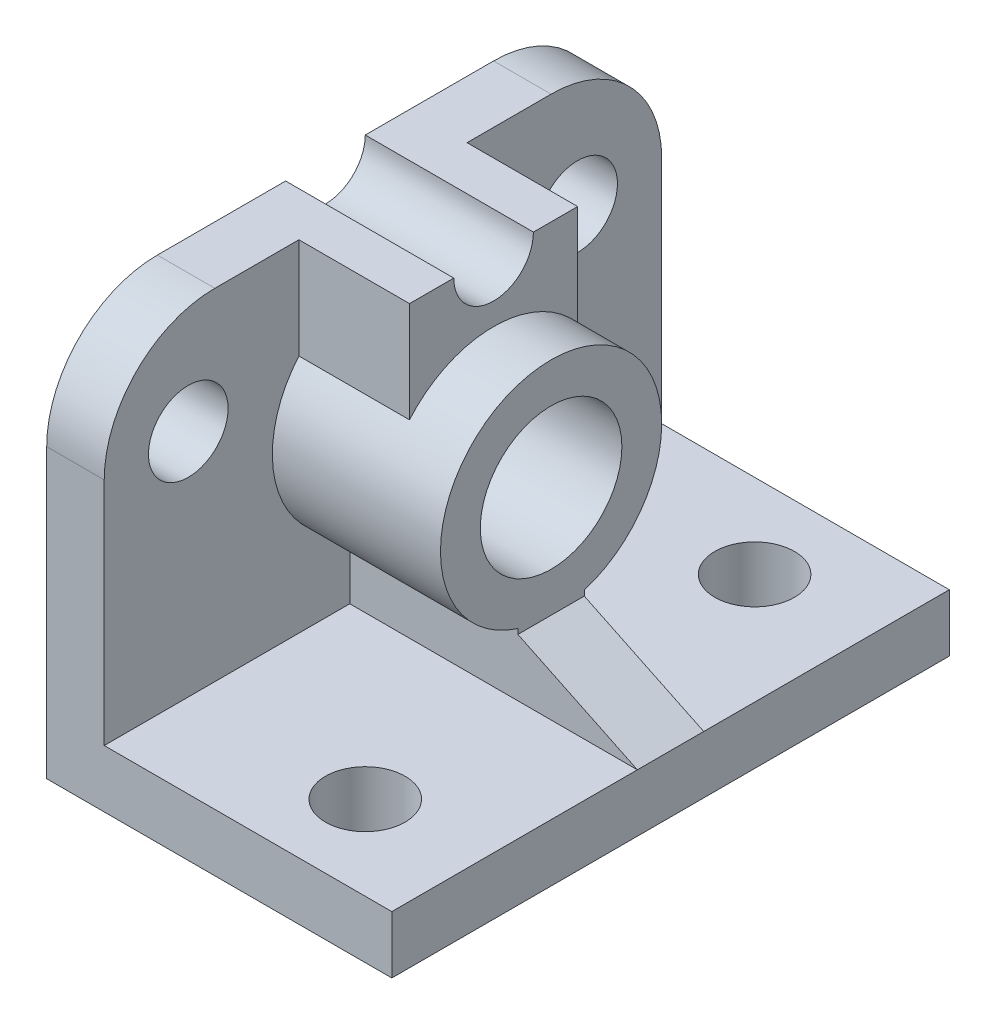
from build123d import *
from build123d.topology import SkipClean

# Parameters (mm, degrees)
SKETCH2_W               = 78
SKETCH2_H               = 126
BOSS_EXTRUDE1_DEPTH     = 13
SKETCH3_W               = 126
SKETCH3_H               = 77
BOSS_EXTRUDE2_DEPTH     = 13
FILLET1_R               = 25
SKETCH4_R               = 9
CUT_EXTRUDE1_DEPTH      = 128.647953372
SKETCH5_R               = 25
BOSS_EXTRUDE3_DEPTH     = 38
BOSS_EXTRUDE4_DEPTH     = 25
CUT_EXTRUDE3_DEPTH      = 128.647953372
CUT_EXTRUDE3_DEPTH_BACK = 128.647953372
SKETCH5_5_R             = 16
RIB1_START              = -7.5
RIB1_DEPTH              = 15
SKETCH7_R               = 9
CUT_EXTRUDE4_DEPTH      = 107.85972113


with BuildPart() as part:
    # Sketch2 → Boss-Extrude1 (new body)
    with BuildSketch(Plane(origin=(0, 0, 0), x_dir=(1, 0, 0), z_dir=(0, 1, 0))):
        Rectangle(SKETCH2_W, SKETCH2_H)
    extrude(amount=BOSS_EXTRUDE1_DEPTH)

    # Sketch3 → Boss-Extrude2 (add)
    with BuildSketch(Plane.ZY.offset(39)):
        with Locations((0, 51.5)):
            Rectangle(SKETCH3_W, SKETCH3_H)
    extrude(amount=-BOSS_EXTRUDE2_DEPTH)

    # Fillet1
    fillet1_edges = [part.edges().sort_by_distance(p)[0] for p in [
        (-32.5, 90, -63),
        (-32.5, 90, 63),
    ]]
    fillet(fillet1_edges, radius=FILLET1_R)

    # Sketch4 → Cut-Extrude1 (cut, through all)
    with BuildSketch(Plane(origin=(-26, 0, 0), x_dir=(0, 0, -1), z_dir=(1, 0, 0))):
        with Locations((-44, 65)):
            Circle(SKETCH4_R)
        with Locations((44, 65)):
            Circle(SKETCH4_R)
    extrude(amount=-CUT_EXTRUDE1_DEPTH, mode=Mode.SUBTRACT)

    # Sketch5 → Boss-Extrude3 (add)
    with BuildSketch(Plane(origin=(-26, 0, 0), x_dir=(0, 0, -1), z_dir=(1, 0, 0))):
        with Locations((0, 51)):
            Circle(SKETCH5_R)
    extrude(amount=BOSS_EXTRUDE3_DEPTH)

    # Sketch5<3> → Boss-Extrude4 (add)
    with BuildSketch(Plane(origin=(-26, 0, 0), x_dir=(0, 0, -1), z_dir=(1, 0, 0))):
        with BuildLine():
            Line((-9, 90), (-19, 90))
            Line((-19, 90), (-19, 67.248076809))
            ThreePointArc((-19, 67.248076809), (0, 76), (19, 67.248076809))
            Line((19, 67.248076809), (19, 90))
            Line((19, 90), (9, 90))
            ThreePointArc((9, 90), (0, 81), (-9, 90))
        make_face()
    extrude(amount=BOSS_EXTRUDE4_DEPTH)

    # Sketch5<5> → Cut-Extrude3 (cut, two sides: drawn at the far end of the back side and taken through both)
    with SkipClean():  # the faces are left unmerged after this step: merging them gives an invalid solid
        with BuildSketch(Plane(origin=(-26, 0, 0), x_dir=(0, 0, -1), z_dir=(1, 0, 0)).offset(-CUT_EXTRUDE3_DEPTH_BACK)):
            with Locations((0, 51)):
                Circle(SKETCH5_5_R)
            with BuildLine():
                Line((9, 90), (-9, 90))
                ThreePointArc((-9, 90), (0, 81), (9, 90))
            make_face()
        extrude(amount=CUT_EXTRUDE3_DEPTH + CUT_EXTRUDE3_DEPTH_BACK, mode=Mode.SUBTRACT)
    add(part.part.scale(1), mode=Mode.REPLACE)  # the faces are merged on a copy

    # Rib1: read off the stored shape, not the designer's step
    # Rib1 outline → Rib1 (add)
    with BuildSketch(Plane.XY.offset(RIB1_START)):
        Polygon((12, 26), (12, 27.151519965), (-26, 27.151519965), (-26, 13), (39, 13), align=None)
    extrude(amount=RIB1_DEPTH)

    # Sketch7 → Cut-Extrude4 (cut, symmetric)
    with BuildSketch(Plane(origin=(0, 13, 0), x_dir=(1, 0, 0), z_dir=(0, 1, 0))):
        with Locations(Location((14, 44, 0), (0, 0, 270))):
            Circle(SKETCH7_R)
    cut_extrude4 = extrude(amount=CUT_EXTRUDE4_DEPTH, both=True, mode=Mode.SUBTRACT)

    # Mirror1: Cut-Extrude4 across plane
    add(cut_extrude4.mirror(Plane.XY), mode=Mode.SUBTRACT)


solid = part.part
